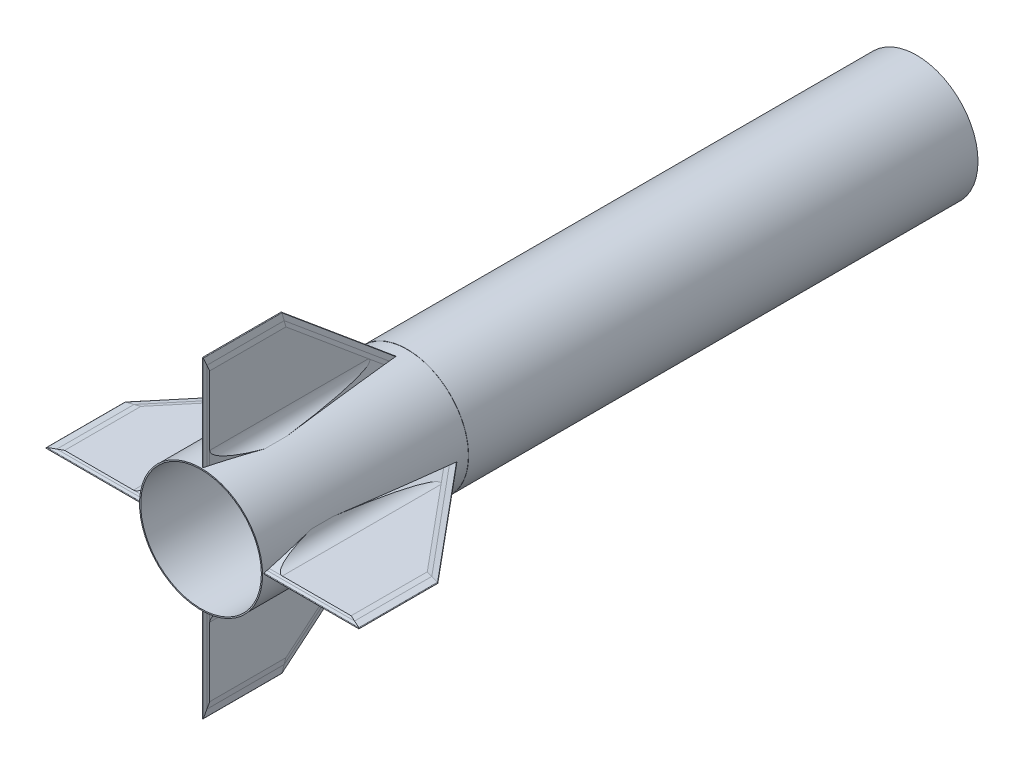
from build123d import *

# Parameters (mm, degrees)
FINBODY_DEPTH            = 3.175
CARBONFIBERX5_DEPTH      = 0.762
CUT_EXTRUDE1_START       = 24.777267503
CUT_EXTRUDE1_OUTLINE_W   = 131
CUT_EXTRUDE1_OUTLINE_H   = 177
CUT_EXTRUDE1_DEPTH       = 3.222732497
CUT_EXTRUDE1_START_2     = 27.910323391
CUT_EXTRUDE1_2_OUTLINE_W = 131
CUT_EXTRUDE1_2_OUTLINE_H = 177
CUT_EXTRUDE1_2_DEPTH     = 3.089676609
CUT_EXTRUDE1_START_3     = -196
CUT_EXTRUDE1_3_DEPTH     = 277.303418757
CUT_EXTRUDE4_DEPTH       = 280.153404373
CUT_EXTRUDE4_DEPTH_BACK  = 280.153404373
CUT_EXTRUDE5_DEPTH       = 277.720944264
CUT_EXTRUDE5_DEPTH_BACK  = 277.720944264
SKETCH13_R               = 78.36
SKETCH13_R_2             = 77.09
BOSS_EXTRUDE1_DEPTH      = 914.4
BOSS_EXTRUDE2_REACH      = 933.171
BOSS_EXTRUDE3_START      = -12.512054024
BOSS_EXTRUDE3_DEPTH      = 28.26665103
BOSS_EXTRUDE3_START_2    = -231.688277832
BOSS_EXTRUDE3_2_DEPTH    = 222.91982446
BOSS_EXTRUDE3_START_3    = -78
BOSS_EXTRUDE3_3_DEPTH    = 92
CIRPATTERN1_COUNT        = 4
SKETCH18_W               = 519.548726742
SKETCH18_H               = 439.659397243
CUT_EXTRUDE6_DEPTH       = 651
SKETCH17_R               = 78.614
SKETCH17_R_2             = 78.36
SKETCH17_R_3             = 77.09
BOSS_EXTRUDE4_DEPTH      = 0.1
SKETCH19_R               = 78.614
SKETCH19_R_2             = 77.09
BOSS_EXTRUDE5_DEPTH      = 0.1
SKETCH20_R               = 78.36
SKETCH20_R_2             = 77.09
BOSS_EXTRUDE6_DEPTH      = 914.4
SKETCH21_W               = 490.676006992
SKETCH21_H               = 455.150743556
CUT_EXTRUDE7_DEPTH       = 263.4


with BuildPart() as part:
    # Sketch1 → FinBody (new body)
    with BuildSketch(Plane(origin=(0, 0, 0), x_dir=(1, 0, 0), z_dir=(0, 1, 0))):
        Polygon((0, 0), (0, 254), (127, 101.6), (127, 0), align=None)
    extrude(amount=FINBODY_DEPTH)

    # Cut-Extrude1 3 outline → Cut-Extrude1 3 (cut)
    with BuildSketch(Plane(origin=(0, 0, 0), x_dir=(0.7682212795973759, 0, -0.6401843996644799), z_dir=(0.6401843996644799, 0, 0.7682212795973759)).offset(CUT_EXTRUDE1_START_3)):
        with BuildLine():
            Line((152.937458047, 3.175), (158.760273677, 2.219021404))
            add(Edge.make_bspline(
                [(158.760273677, 2.219021404), (159.124298163, 2.159256568), (159.124298163, 1.5875), (159.124298163, 1.015743432), (158.760273677, 0.955978596)],
                knots=[1.675516082, 1.675516082, 1.675516082, 3.141592654, 3.141592654, 4.607669225, 4.607669225, 4.607669225], degree=2, weights=[1, 0.743144825, 1, 0.743144825, 1]))
            Line((158.760273677, 0.955978596), (152.937458047, 0))
            Line((152.937458047, 0), (162.606837515, 0))
            Line((162.606837515, 0), (162.606837515, 3.175))
            Line((162.606837515, 3.175), (152.937458047, 3.175))
        make_face()
    extrude(amount=CUT_EXTRUDE1_3_DEPTH, mode=Mode.SUBTRACT)


with BuildPart() as body_2:
    # Sketch2 → CarbonFiberx5 (new body)
    with BuildSketch(Plane(origin=(0, 3.175, 0), x_dir=(1, 0, 0), z_dir=(0, 1, 0))):
        Polygon((0, 0), (127, 0), (127, 101.6), (0, 254), align=None)
    extrude(amount=CARBONFIBERX5_DEPTH)


with BuildPart() as body_3:
    # Mirror2: mirrored copy
    add(body_2.part.mirror(Plane.ZX.offset(1.5875)))

    # Cut-Extrude1: read off the stored shape, not the designer's step
    # Cut-Extrude1 outline → Cut-Extrude1 (cut)
    with BuildSketch(Plane(origin=(0, 0, 0), x_dir=(0.9922247669521616, 0.12377707738096075, 0.013009495061545442), z_dir=(0.12445887612672998, -0.9867892558606077, -0.10371573010560797)).offset(CUT_EXTRUDE1_START)):
        with Locations((60.5, -165.5)):
            Rectangle(CUT_EXTRUDE1_OUTLINE_W, CUT_EXTRUDE1_OUTLINE_H)
    extrude(amount=CUT_EXTRUDE1_DEPTH, mode=Mode.SUBTRACT)


with BuildPart() as body_2_1:
    add(body_2.part)

    # Cut-Extrude1 2 outline → Cut-Extrude1 2 (cut)
    with BuildSketch(Plane(origin=(0, 0, 0), x_dir=(0.9922247669521616, -0.12377707738096075, 0.013009495061545442), z_dir=(0.12445887612672998, 0.9867892558606077, -0.10371573010560797)).offset(CUT_EXTRUDE1_START_2)):
        with Locations((60.5, 165.5)):
            Rectangle(CUT_EXTRUDE1_2_OUTLINE_W, CUT_EXTRUDE1_2_OUTLINE_H)
    extrude(amount=CUT_EXTRUDE1_2_DEPTH, mode=Mode.SUBTRACT)


with BuildPart() as cut_extrude4_tool:
    # Sketch11 → Cut-Extrude4 (new, two sides: drawn at the far end of the back side and taken through both)
    with BuildSketch(Plane.XY.offset(-CUT_EXTRUDE4_DEPTH_BACK)):
        with BuildLine():
            Line((111.895946429, 3.175), (120.991475206, 2.219021404))
            ThreePointArc((120.991475206, 2.219021404), (121.560099632, 1.5875), (120.991475206, 0.955978596))
            Line((120.991475206, 0.955978596), (111.895946429, 0))
            Line((111.895946429, 0), (127, 0))
            Line((127, 0), (127, 3.175))
            Line((127, 3.175), (111.895946429, 3.175))
        make_face()
        Polygon((104.646000715, 3.937), (111.895946429, 3.175), (127, 3.175), (127, 3.937), align=None)
        Polygon((127, 0), (111.895946429, 0), (104.646000715, -0.762), (127, -0.762), align=None)
    extrude(amount=CUT_EXTRUDE4_DEPTH + CUT_EXTRUDE4_DEPTH_BACK)


with BuildPart() as part_1:
    add(part.part)

    # Cut-Extrude4: cut by cut_extrude4_tool
    add(cut_extrude4_tool.part, mode=Mode.SUBTRACT)


with BuildPart() as body_2_2:
    add(body_2_1.part)

    # Cut-Extrude4: cut by cut_extrude4_tool
    add(cut_extrude4_tool.part, mode=Mode.SUBTRACT)


with BuildPart() as body_3_1:
    add(body_3.part)

    # Cut-Extrude4: cut by cut_extrude4_tool
    add(cut_extrude4_tool.part, mode=Mode.SUBTRACT)


with BuildPart() as cut_extrude5_tool:
    # Sketch12 → Cut-Extrude5 (new, two sides: drawn at the far end of the back side and taken through both)
    with BuildSketch(Plane.ZY.offset(-CUT_EXTRUDE5_DEPTH_BACK)):
        with BuildLine():
            Line((-5.924630657, 3.175), (-2.289101505, 2.2008629))
            ThreePointArc((-2.289101505, 2.2008629), (-1.818451599, 1.5875), (-2.289101505, 0.9741371))
            Line((-2.289101505, 0.9741371), (-5.924630657, 0))
            Line((-5.924630657, 0), (0, 0))
            Line((0, 0), (0, 3.175))
            Line((0, 3.175), (-5.924630657, 3.175))
        make_face()
        Polygon((-8.768453372, 3.937), (-5.924630657, 3.175), (0, 3.175), (0, 3.937), align=None)
        Polygon((0, 0), (-5.924630657, 0), (-8.768453372, -0.762), (0, -0.762), align=None)
    extrude(amount=CUT_EXTRUDE5_DEPTH + CUT_EXTRUDE5_DEPTH_BACK)


with BuildPart() as part_2:
    add(part_1.part)

    # Cut-Extrude5: cut by cut_extrude5_tool
    add(cut_extrude5_tool.part, mode=Mode.SUBTRACT)



with BuildPart() as body_2_3:
    add(body_2_2.part)

    # Cut-Extrude5: cut by cut_extrude5_tool
    add(cut_extrude5_tool.part, mode=Mode.SUBTRACT)


with BuildPart() as body_3_2:
    add(body_3_1.part)

    # Cut-Extrude5: cut by cut_extrude5_tool
    add(cut_extrude5_tool.part, mode=Mode.SUBTRACT)


with BuildPart() as body_4:
    # Sketch13 → Boss-Extrude1 (new body)
    with BuildSketch(Plane.XY):
        with Locations((-78.36, 1.5875)):
            Circle(SKETCH13_R)
        with Locations((-78.36, 1.5875)):
            Circle(SKETCH13_R_2, mode=Mode.SUBTRACT)
    extrude(amount=-BOSS_EXTRUDE1_DEPTH)


with BuildPart() as part_3:
    add(part_2.part)

    # Boss-Extrude2: up to this face of the body
    boss_extrude2_end = body_4.part.faces().sort_by_distance((-156.72, 1.5875, -457.2))[0]
    # Sketch14 → Boss-Extrude2 (add, up to the picked face)
    with BuildSketch(Plane.ZY, mode=Mode.PRIVATE) as boss_extrude2_sk1:
        with BuildLine():
            ThreePointArc((-2.289101505, 0.9741371), (-1.818451599, 1.5875), (-2.289101505, 2.2008629))
            Line((-2.289101505, 2.2008629), (-5.924630657, 3.175))
            Line((-5.924630657, 3.175), (-238.895946429, 3.175))
            Line((-238.895946429, 3.175), (-247.991475206, 2.219021404))
            ThreePointArc((-247.991475206, 2.219021404), (-248.560099632, 1.5875), (-247.991475206, 0.955978596))
            Line((-247.991475206, 0.955978596), (-238.895946429, 0))
            Line((-238.895946429, 0), (-5.924630657, 0))
            Line((-5.924630657, 0), (-2.289101505, 0.9741371))
        make_face()
    boss_extrude2_tool1 = split(extrude(boss_extrude2_sk1.sketch, amount=BOSS_EXTRUDE2_REACH, mode=Mode.PRIVATE), bisect_by=boss_extrude2_end, keep=Keep.BOTH, mode=Mode.PRIVATE)
    # Sketch14 → Boss-Extrude2 (add, up to the picked face)
    with BuildSketch(Plane.ZY, mode=Mode.PRIVATE) as boss_extrude2_sk2:
        Polygon((-238.895946429, 3.175), (-5.924630657, 3.175), (-8.768453372, 3.937), (-231.646000715, 3.937), align=None)
    boss_extrude2_tool2 = split(extrude(boss_extrude2_sk2.sketch, amount=BOSS_EXTRUDE2_REACH, mode=Mode.PRIVATE), bisect_by=boss_extrude2_end, keep=Keep.BOTH, mode=Mode.PRIVATE)
    # Sketch14 → Boss-Extrude2 (add, up to the picked face)
    with BuildSketch(Plane.ZY, mode=Mode.PRIVATE) as boss_extrude2_sk3:
        Polygon((-8.768453372, -0.762), (-5.924630657, 0), (-238.895946429, 0), (-231.646000715, -0.762), align=None)
    boss_extrude2_tool3 = split(extrude(boss_extrude2_sk3.sketch, amount=BOSS_EXTRUDE2_REACH, mode=Mode.PRIVATE), bisect_by=boss_extrude2_end, keep=Keep.BOTH, mode=Mode.PRIVATE)
    add(boss_extrude2_tool1.solids().sort_by(Axis((0, 1.5875, -124.365106), (-1, 0, 0)))[0])
    add(boss_extrude2_tool1.solids().sort_by(Axis((0, 1.5875, -124.365106), (-1, 0, 0)))[1])
    add(boss_extrude2_tool2.solids().sort_by(Axis((0, 3.553188, -121.316888), (-1, 0, 0)))[0])
    add(boss_extrude2_tool3.solids().sort_by(Axis((0, -0.378188, -121.316888), (-1, 0, 0)))[0])


with BuildPart() as body_5:
    # Boss-Extrude3: read off the stored shape, not the designer's step
    # Boss-Extrude3 outline → Boss-Extrude3 (new body)
    with BuildSketch(Plane.XY.offset(-80).offset(BOSS_EXTRUDE3_START)):
        with BuildLine():
            Line((-0.035230931, 3.937), (16.670360937, 3.937))
            ThreePointArc((16.670360937, 3.937), (4.771236529, 8.110396277), (-1.914264624, 18.80200385))
            ThreePointArc((-1.914264624, 18.80200385), (-0.618638123, 11.414516514), (-0.035230931, 3.937))
        make_face()
    extrude(amount=BOSS_EXTRUDE3_DEPTH)

    # Boss-Extrude3 2 outline → Boss-Extrude3 2 (add)
    with BuildSketch(Plane.XY.offset(BOSS_EXTRUDE3_START_2)):
        with BuildLine():
            Line((-0.035230931, 3.937), (16.670360937, 3.937))
            ThreePointArc((16.670360937, 3.937), (4.771236529, 8.110396277), (-1.914264624, 18.80200385))
            ThreePointArc((-1.914264624, 18.80200385), (-0.618638123, 11.414516514), (-0.035230931, 3.937))
        make_face()
    extrude(amount=BOSS_EXTRUDE3_2_DEPTH)

    # Boss-Extrude3 3 outline → Boss-Extrude3 3 (cut)
    with BuildSketch(Plane(origin=(0, 0, 0), x_dir=(0.08100015681862362, 0.9963378062365744, 0.02738522337043979), z_dir=(0.9438539434124279, -0.08550424471153754, 0.31910618552625897)).offset(BOSS_EXTRUDE3_START_3)):
        Polygon((3.679602178, -8.295275792), (16.818716822, -60.248063362), (18.726719461, -67.792411551), (20, -58.66170214), (20, -6), (3.099115679, -6), align=None)
        Polygon((20, -72.827033378), (18.726719461, -67.792411551), (16.04462827, -87.025718364), (-2.425107008, -219.47240273), (-3.335382672, -226), (20, -226), align=None)
    extrude(amount=BOSS_EXTRUDE3_3_DEPTH, mode=Mode.SUBTRACT)


with BuildPart() as body_6:
    # Mirror3: mirrored copy
    add(body_5.part.mirror(Plane.ZX.offset(1.5875)))


with BuildPart() as cirpattern1_1:
    # CirPattern1: pattern copy
    add(body_6.part.rotate(Axis((-78.36, 1.5875, -914.4), (0, 0, 1)), 1 * 360 / CIRPATTERN1_COUNT))


with BuildPart() as cirpattern1_2:
    # CirPattern1: pattern copy
    add(body_6.part.rotate(Axis((-78.36, 1.5875, -914.4), (0, 0, 1)), 2 * 360 / CIRPATTERN1_COUNT))


with BuildPart() as cirpattern1_3:
    # CirPattern1: pattern copy
    add(body_6.part.rotate(Axis((-78.36, 1.5875, -914.4), (0, 0, 1)), 3 * 360 / CIRPATTERN1_COUNT))


with BuildPart() as cirpattern1_4:
    # CirPattern1: pattern copy
    add(body_3_2.part.rotate(Axis((-78.36, 1.5875, -914.4), (0, 0, 1)), 1 * 360 / CIRPATTERN1_COUNT))


with BuildPart() as cirpattern1_5:
    # CirPattern1: pattern copy
    add(body_3_2.part.rotate(Axis((-78.36, 1.5875, -914.4), (0, 0, 1)), 2 * 360 / CIRPATTERN1_COUNT))


with BuildPart() as cirpattern1_6:
    # CirPattern1: pattern copy
    add(body_3_2.part.rotate(Axis((-78.36, 1.5875, -914.4), (0, 0, 1)), 3 * 360 / CIRPATTERN1_COUNT))


with BuildPart() as cirpattern1_7:
    # CirPattern1: pattern copy
    add(part_3.part.rotate(Axis((-78.36, 1.5875, -914.4), (0, 0, 1)), 1 * 360 / CIRPATTERN1_COUNT))


with BuildPart() as cirpattern1_8:
    # CirPattern1: pattern copy
    add(part_3.part.rotate(Axis((-78.36, 1.5875, -914.4), (0, 0, 1)), 2 * 360 / CIRPATTERN1_COUNT))


with BuildPart() as cirpattern1_9:
    # CirPattern1: pattern copy
    add(part_3.part.rotate(Axis((-78.36, 1.5875, -914.4), (0, 0, 1)), 3 * 360 / CIRPATTERN1_COUNT))


with BuildPart() as cirpattern1_10:
    # CirPattern1: pattern copy
    add(body_2_3.part.rotate(Axis((-78.36, 1.5875, -914.4), (0, 0, 1)), 1 * 360 / CIRPATTERN1_COUNT))


with BuildPart() as cirpattern1_11:
    # CirPattern1: pattern copy
    add(body_2_3.part.rotate(Axis((-78.36, 1.5875, -914.4), (0, 0, 1)), 2 * 360 / CIRPATTERN1_COUNT))


with BuildPart() as cirpattern1_12:
    # CirPattern1: pattern copy
    add(body_2_3.part.rotate(Axis((-78.36, 1.5875, -914.4), (0, 0, 1)), 3 * 360 / CIRPATTERN1_COUNT))


with BuildPart() as cirpattern1_13:
    # CirPattern1: pattern copy
    add(body_5.part.rotate(Axis((-78.36, 1.5875, -914.4), (0, 0, 1)), 1 * 360 / CIRPATTERN1_COUNT))


with BuildPart() as cirpattern1_14:
    # CirPattern1: pattern copy
    add(body_5.part.rotate(Axis((-78.36, 1.5875, -914.4), (0, 0, 1)), 2 * 360 / CIRPATTERN1_COUNT))


with BuildPart() as cirpattern1_15:
    # CirPattern1: pattern copy
    add(body_5.part.rotate(Axis((-78.36, 1.5875, -914.4), (0, 0, 1)), 3 * 360 / CIRPATTERN1_COUNT))


with BuildPart() as body_4_1:
    add(body_4.part)

    # Sketch18 → Cut-Extrude6 (cut)
    with BuildSketch(Plane(origin=(0, 0, -914.4), x_dir=(-1, 0, 0), z_dir=(0, 0, -1))):
        with Locations((83.18552997, 2.793882493)):
            Rectangle(SKETCH18_W, SKETCH18_H)
    extrude(amount=-CUT_EXTRUDE6_DEPTH, mode=Mode.SUBTRACT)

    # Sketch17 → Boss-Extrude4 (add)
    # profile 1 of 2: a face of its own
    with BuildSketch(Plane.XY):
        with Locations((-78.36, 1.5875)):
            Circle(SKETCH17_R)
        with Locations((-78.36, 1.5875)):
            Circle(SKETCH17_R_2, mode=Mode.SUBTRACT)
    # profile 2 of 2: a face of its own
    with BuildSketch(Plane.XY):
        with Locations((-78.36, 1.5875)):
            Circle(SKETCH17_R_2)
        with Locations((-78.36, 1.5875)):
            Circle(SKETCH17_R_3, mode=Mode.SUBTRACT)
    extrude(amount=-BOSS_EXTRUDE4_DEPTH)

    # Sketch19 → Boss-Extrude5 (add)
    with BuildSketch(Plane(origin=(0, 0, -263.4), x_dir=(-1, 0, 0), z_dir=(0, 0, -1))):
        with Locations(Location((78.36, 1.5875, 0), (0, 0, 180))):
            Circle(SKETCH19_R)
        with Locations(Location((78.36, 1.5875, 0), (0, 0, 180))):
            Circle(SKETCH19_R_2, mode=Mode.SUBTRACT)
    extrude(amount=-BOSS_EXTRUDE5_DEPTH)

    # Sketch20 → Boss-Extrude6 (add)
    with BuildSketch(Plane(origin=(0, 0, -263.4), x_dir=(-1, 0, 0), z_dir=(0, 0, -1))):
        with Locations(Location((78.36, 1.5875, 0), (0, 0, 180))):
            Circle(SKETCH20_R)
        with Locations(Location((78.36, 1.5875, 0), (0, 0, 180))):
            Circle(SKETCH20_R_2, mode=Mode.SUBTRACT)
    extrude(amount=BOSS_EXTRUDE6_DEPTH)

    # Sketch21 → Cut-Extrude7 (cut)
    with BuildSketch(Plane(origin=(0, 0, -1177.8), x_dir=(-1, 0, 0), z_dir=(0, 0, -1))):
        with Locations((78.493553622, -8.429021645)):
            Rectangle(SKETCH21_W, SKETCH21_H)
    extrude(amount=-CUT_EXTRUDE7_DEPTH, mode=Mode.SUBTRACT)


solid = Compound([body_2_3.part, body_3_2.part, part_3.part, body_5.part, body_6.part, cirpattern1_1.part, cirpattern1_2.part, cirpattern1_3.part, cirpattern1_4.part, cirpattern1_5.part, cirpattern1_6.part, cirpattern1_7.part, cirpattern1_8.part, cirpattern1_9.part, cirpattern1_10.part, cirpattern1_11.part, cirpattern1_12.part, cirpattern1_13.part, cirpattern1_14.part, cirpattern1_15.part, body_4_1.part])
